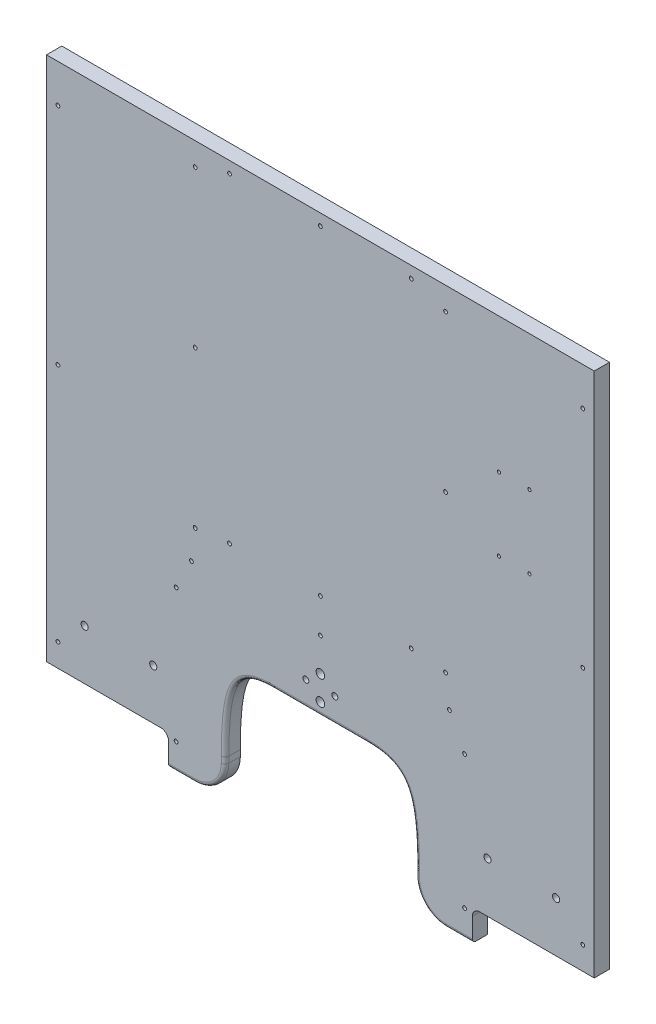
from build123d import *

# Parameters (mm, degrees)
BOSS_EXTRUDE1_DEPTH              = 12.7
FILLET2_SIZE                     = 41.275
FILLET2_SIZE_2                   = 69.85
FILLET3_R                        = 25.4
FILLET4_R                        = 19.05
FILLET5_START                    = -1
FILLET5_DEPTH                    = 15
FILLET6_R                        = 127
CUT_EXTRUDE1_REACH               = 634.314
SKETCH3_W                        = 241.600142069
SKETCH3_H                        = 584.2
F_1_4_CLEARANCE_HOLE1_D          = 7.14248
F_8_CLEARANCE_HOLE1_D            = 4.9149
HOLE1_D                          = 3.175
HOLE1_DEPTH                      = 38.1
HOLE1_CSINK_D                    = 10.16
HOLE1_CSINK_ANGLE                = 82
HOLE1_TIP                        = 0.953866233
CUT_EXTRUDE2_REACH               = 634.314
SKETCH12_W                       = 186.712242296
SKETCH12_H                       = 157.887445213
FILLET8_R                        = 6.35
FILLET8_OF_MIRROR6_R             = 6.35
FILLET7_R                        = 3.175
F_15_64_0_23438_DIAMETER_HOLE1_D = 5.953252
F_2_CLEARANCE_HOLE1_D            = 2.7051


with BuildPart() as part:
    # Sketch1 → Boss-Extrude1 (new body)
    with BuildSketch(Plane.XY):
        Polygon((-228.088766336, 0), (228.088766336, 0), (228.088766336, -443.878997916), (241.600142069, -584.2), (237.284597128, -584.2), (202.688766336, -463.55), (79.375, -463.55), (79.375, -363.22), (-79.375, -363.22), (-79.375, -463.55), (-202.688766336, -463.55), (-237.284597128, -584.2), (-241.600142069, -584.2), (-228.088766336, -443.878997916), align=None)
    extrude(amount=BOSS_EXTRUDE1_DEPTH)

    # Fillet2
    # a fillet whose section is not a circle: 69.85, 41.275 mm, written as the material it adds along each edge
    with BuildSketch(Plane(origin=(-79.375, -363.22, 0), x_dir=(1, 0, 0), z_dir=(0, 0, 1))) as fillet2_piece_1:
        with BuildLine():
            Bezier((FILLET2_SIZE, 0), (0, 0), (0, -FILLET2_SIZE_2), weights=[1, 1.5, 1])
            Line((0, -FILLET2_SIZE_2), (0, 0))
            Line((0, 0), (FILLET2_SIZE, 0))
        make_face()
    extrude(amount=12.7)

    # Fillet3
    fillet3_edges = [part.edges().sort_by_distance(p)[0] for p in [
        (-79.375, -463.55, 6.35),
    ]]
    fillet(fillet3_edges, radius=FILLET3_R)

    # Fillet4
    fillet4_edges = [part.edges().sort_by_distance(p)[0] for p in [
        (-202.688766336, -463.55, 6.35),
    ]]
    fillet(fillet4_edges, radius=FILLET4_R)

    # Fillet5: read off the stored shape, not the designer's step
    # Fillet5 outline → Fillet5 (cut)
    with BuildSketch(Plane.XY.offset(FILLET5_START)):
        with BuildLine():
            Line((-237.284597128, -584.2), (-224.526592015, -539.707548693))
            add(Edge.make_bspline(
                [(-224.526592015, -539.707548693), (-237.177095318, -583.825096633), (-241.600142069, -584.2)],
                knots=[0, 0, 0, 1, 1, 1], degree=2, weights=[1, 2.333333333, 1]))
            Line((-241.600142069, -584.2), (-237.284597128, -584.2))
        make_face()
    extrude(amount=FILLET5_DEPTH, mode=Mode.SUBTRACT)

    # Fillet6
    # the kernel refuses this fillet: 127 mm, written as the material it adds along each edge
    with BuildSketch(Plane(origin=(-228.088766336, -443.878997916, 0), x_dir=(0, 1, 0), z_dir=(0, 0, 1))) as fillet6_piece_1:
        with BuildLine():
            CenterArc((FILLET6_R * 0.0480334444852, FILLET6_R), FILLET6_R, 264.5, 5.5)
            Line((-FILLET6_R * 0.047812308035, FILLET6_R * 0.00460380163282), (0, 0))
            Line((0, 0), (FILLET6_R * 0.0480334444852, 0))
        make_face()
    extrude(amount=12.7)

    # Sketch3 → Cut-Extrude1 (cut, up to next)
    with BuildSketch(Plane.XY.offset(12.7), mode=Mode.PRIVATE) as cut_extrude1_sk1:
        with Locations((120.800071035, -292.1)):
            Rectangle(SKETCH3_W, SKETCH3_H)
    cut_extrude1_tool1 = extrude(cut_extrude1_sk1.sketch, amount=-CUT_EXTRUDE1_REACH, mode=Mode.PRIVATE) & part.part
    add(cut_extrude1_tool1.solids().sort_by_distance((120.800071, -292.1, 12.7))[0], mode=Mode.SUBTRACT)

    # Mirror5: part across plane


with BuildPart() as part_1:
    add(part.part)
    add(part.part.mirror(Plane(origin=(0, 0, -0.35025), x_dir=(0, 0, 1), z_dir=(-1, 0, 0))))

    # 1/4 Clearance Hole1 (through all)
    with Locations(Plane.XY.offset(12.7)):
        with Locations((0, -332.4225), (0, -352.7425)):
            Hole(F_1_4_CLEARANCE_HOLE1_D / 2)

    # #8 Clearance Hole1 (through all)
    with Locations(Plane.XY.offset(12.7)):
        with Locations((-12.077216058, -342.5825), (12.077216058, -342.5825)):
            Hole(F_8_CLEARANCE_HOLE1_D / 2)

    # Hole1
    with Locations(Plane(origin=(0, 0, -12.7), x_dir=(-1, 0, 0), z_dir=(0, 0, -1))):
        with Locations((-75.688766336, -9.525), (218.563766336, -31.75), (218.563766336, -218.821), (218.563766336, -418.592), (104.263766336, -19.05), (104.263766336, -149.225), (104.263766336, -279.4), (120.138766336, -330.2), (120.138766336, -441.325), (-120.138766336, -441.325), (-120.138766336, -330.2), (-104.263766336, -279.4), (-104.263766336, -149.225), (-104.263766336, -19.05), (-218.563766336, -418.592), (-218.563766336, -218.821), (-218.563766336, -31.75), (0, -304.8), (107.438766336, -304.8), (-107.438766336, -304.8), (75.688766336, -276.225), (0, -276.225), (-75.688766336, -276.225), (75.688766336, -9.525), (0, -9.525)):
            CounterSinkHole(HOLE1_D / 2, HOLE1_CSINK_D / 2, depth=HOLE1_DEPTH, counter_sink_angle=HOLE1_CSINK_ANGLE)
            with Locations((0, 0, -(HOLE1_DEPTH + HOLE1_TIP / 2))):  # 118° drill point
                Cone(0, HOLE1_D / 2, HOLE1_TIP, mode=Mode.SUBTRACT)

    # Sketch12 → Cut-Extrude2 (cut, up to next)
    with BuildSketch(Plane(origin=(0, 0, 0), x_dir=(-1, 0, 0), z_dir=(0, 0, -1)), mode=Mode.PRIVATE) as cut_extrude2_sk1:
        with Locations((219.844887484, -516.722473073)):
            Rectangle(SKETCH12_W, SKETCH12_H)
    cut_extrude2_tool1 = extrude(cut_extrude2_sk1.sketch, amount=-CUT_EXTRUDE2_REACH, mode=Mode.PRIVATE) & part_1.part
    cut_extrude2 = cut_extrude2_tool1.solids().sort_by_distance((-219.844887, -516.722473, 0))[0]
    add(cut_extrude2, mode=Mode.SUBTRACT)

    # Fillet8
    fillet8_edges = [part_1.edges().sort_by_distance(p)[0] for p in [
        (-126.488766336, -437.778750467, 6.35),
    ]]
    fillet(fillet8_edges, radius=FILLET8_R)

    # Mirror6: Cut-Extrude2 across plane
    add(cut_extrude2.mirror(Plane(origin=(0, 0, 0), x_dir=(0, 0, 1), z_dir=(1, 0, 0))), mode=Mode.SUBTRACT)

    # Fillet8 of Mirror6
    fillet8_of_mirror6_edges = [part_1.edges().sort_by_distance(p)[0] for p in [
        (126.488766336, -437.778750467, 6.35),
    ]]
    fillet(fillet8_of_mirror6_edges, radius=FILLET8_OF_MIRROR6_R)

    # Fillet7
    fillet7_edges = [part_1.edges().sort_by_distance(p)[0] for p in [
        (115.631883168, -463.55, 12.7),
        (86.814487758, -456.110512242, 12.7),
        (79.375, -435.61, 12.7),
        (74.895581782, -386.035681558, 12.7),
        (0, -363.22, 12.7),
        (-74.895581782, -386.035681558, 12.7),
        (-79.375, -435.61, 12.7),
        (-86.814487758, -456.110512242, 12.7),
        (-115.631883168, -463.55, 12.7),
    ]]
    fillet(fillet7_edges, radius=FILLET7_R)

    # 15/64 (0.23438) Diameter Hole1 (through all)
    with Locations(Plane.XY.offset(12.7)):
        with Locations((-139.188766336, -395.96042187), (-196.338766336, -395.96042187), (139.188766336, -395.96042187), (196.338766336, -395.96042187)):
            Hole(F_15_64_0_23438_DIAMETER_HOLE1_D / 2)

    # #2 Clearance Hole1 (through all)
    with Locations(Plane.XY.offset(12.7)):
        with Locations((148.713766336, -112.522), (174.113766336, -112.522), (174.113766336, -173.228), (148.713766336, -173.228)):
            Hole(F_2_CLEARANCE_HOLE1_D / 2)


solid = part_1.part
